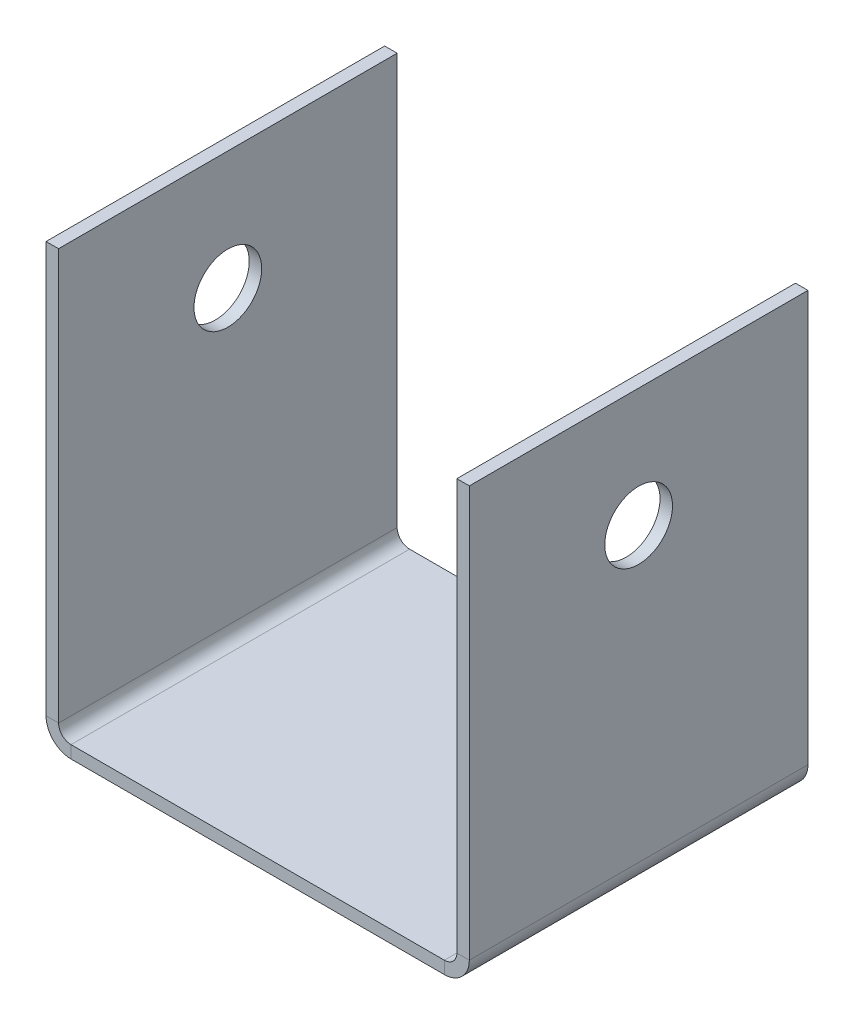
from build123d import *

# Parameters (mm, degrees)
SKETCH1_W                      = 25
SKETCH1_H                      = 20
BASE_FLANGE1_DEPTH             = 0.7366
EDGE_FLANGE1_STRIP_W           = 4.4196
EDGE_FLANGE1_STRIP_H           = 0.7366
EDGE_FLANGE1_STRIP_CUT_DEPTH   = 20
EDGE_FLANGE1_STRIP_2_W         = 4.4196
EDGE_FLANGE1_STRIP_2_H         = 0.7366
EDGE_FLANGE1_STRIP_CUT_2_DEPTH = 20
EDGE_FLANGE1_DEPTH             = 20
EDGE_FLANGE1_BEND_DEPTH        = 20
F_4_0_4_DIAMETER_HOLE1_D       = 4


# Sheet-metal steps are written as plain solids
with BuildPart() as part:
    # Sketch1 → Base-Flange1 (new body)
    with BuildSketch(Plane(origin=(0, 0, 0), x_dir=(1, 0, 0), z_dir=(0, 1, 0))):
        Rectangle(SKETCH1_W, SKETCH1_H)
    extrude(amount=-BASE_FLANGE1_DEPTH)

    # Edge-Flange1 strip (across the edge) → Edge-Flange1 strip cut (cut)
    with BuildSketch(Plane(origin=(12.5, 0, 10), x_dir=(-1, 0, 0), z_dir=(0, 0, -1))):
        with Locations((-0.7366, -0.3683)):
            Rectangle(EDGE_FLANGE1_STRIP_W, EDGE_FLANGE1_STRIP_H)
    extrude(amount=EDGE_FLANGE1_STRIP_CUT_DEPTH, mode=Mode.SUBTRACT)

    # Edge-Flange1 strip 2 (across the edge) → Edge-Flange1 strip cut 2 (cut)
    with BuildSketch(Plane(origin=(-12.5, 0, -10), x_dir=(1, 0, 0), z_dir=(0, 0, 1))):
        with Locations((-0.7366, -0.3683)):
            Rectangle(EDGE_FLANGE1_STRIP_2_W, EDGE_FLANGE1_STRIP_2_H)
    extrude(amount=EDGE_FLANGE1_STRIP_CUT_2_DEPTH, mode=Mode.SUBTRACT)

    # Edge-Flange1 section (across the edge) → Edge-Flange1 (add)
    with BuildSketch(Plane(origin=(12.5, 0, 10), x_dir=(-1, 0, 0), z_dir=(0, 0, -1))):
        with BuildLine():
            Line((0, 0.7366), (0, 25))
            Line((0, 25), (0.7366, 25))
            Line((0.7366, 25), (0.7366, 0.7366))
            ThreePointArc((0.7366, 0.7366), (0.952345145, 0.215745145), (1.4732, 0))
            Line((1.4732, 0), (1.4732, -0.7366))
            ThreePointArc((1.4732, -0.7366), (0.43149029, -0.30510971), (0, 0.7366))
        make_face()
    extrude(amount=EDGE_FLANGE1_DEPTH)

    # Edge-Flange1 section 2 (across the edge) → Edge-Flange1 bend (add)
    with BuildSketch(Plane(origin=(-12.5, 0, -10), x_dir=(1, 0, 0), z_dir=(0, 0, 1))):
        with BuildLine():
            Line((0, 0.7366), (0, 25))
            Line((0, 25), (0.7366, 25))
            Line((0.7366, 25), (0.7366, 0.7366))
            ThreePointArc((0.7366, 0.7366), (0.952345145, 0.215745145), (1.4732, 0))
            Line((1.4732, 0), (1.4732, -0.7366))
            ThreePointArc((1.4732, -0.7366), (0.43149029, -0.30510971), (0, 0.7366))
        make_face()
    extrude(amount=EDGE_FLANGE1_BEND_DEPTH)

    # Ø4.0 (4) Diameter Hole1 (through all)
    with Locations(Plane(origin=(12.5, 0, 0), x_dir=(0, 0, -1), z_dir=(1, 0, 0))):
        with Locations((0, 17.9834)):
            Hole(F_4_0_4_DIAMETER_HOLE1_D / 2)


solid = part.part
